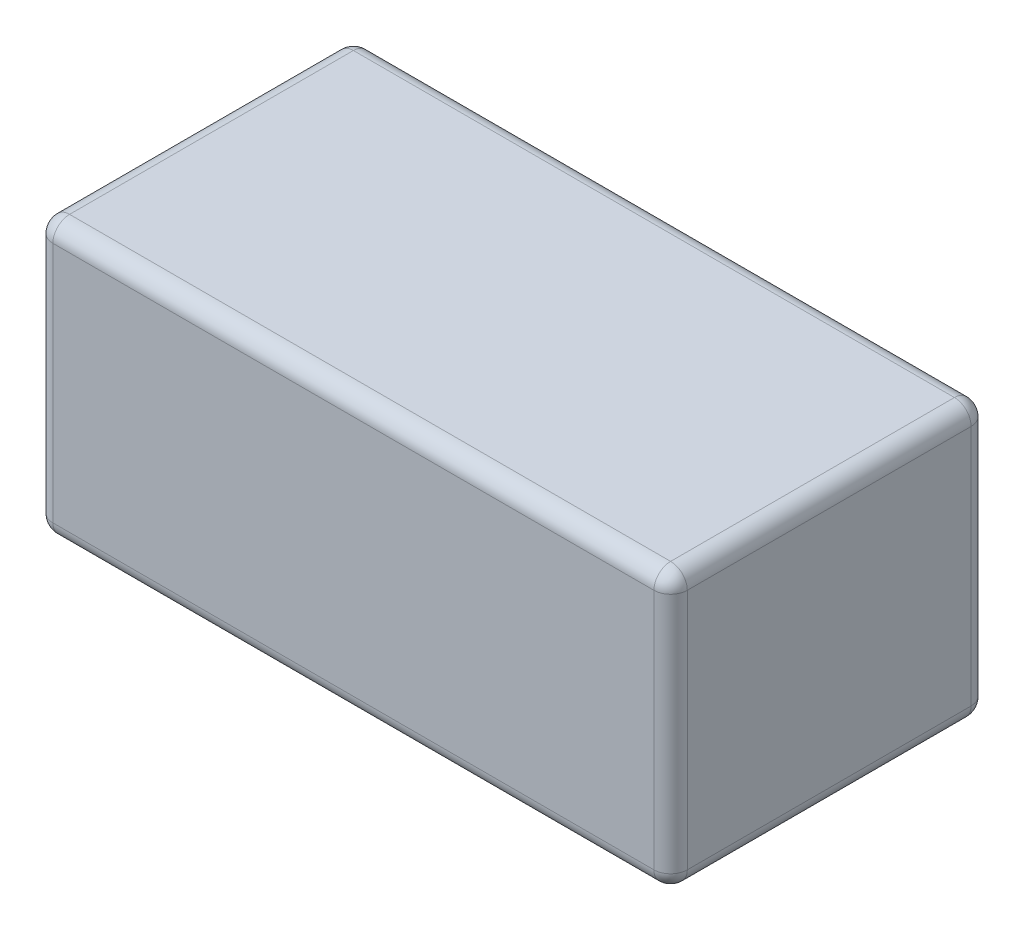
from build123d import *

# Parameters (mm, degrees)
SKETCH1_W           = 76
SKETCH1_H           = 38
BOSS_EXTRUDE1_DEPTH = 33
FILLET1_R           = 2


with BuildPart() as part:
    # Sketch1 → Boss-Extrude1 (new body)
    with BuildSketch(Plane(origin=(0, 0, 0), x_dir=(1, 0, 0), z_dir=(0, 1, 0))):
        Rectangle(SKETCH1_W, SKETCH1_H)
    extrude(amount=BOSS_EXTRUDE1_DEPTH)

    # Fillet1
    fillet1_edges = [part.edges().sort_by_distance(p)[0] for p in [
        (0, 33, 19),
        (-38, 33, 0),
        (-38, 16.5, 19),
        (-38, 0, 0),
        (0, 0, 19),
        (0, 33, -19),
        (-38, 16.5, -19),
        (0, 0, -19),
        (38, 16.5, 19),
        (38, 33, 0),
        (38, 16.5, -19),
        (38, 0, 0),
    ]]
    fillet(fillet1_edges, radius=FILLET1_R)


solid = part.part
